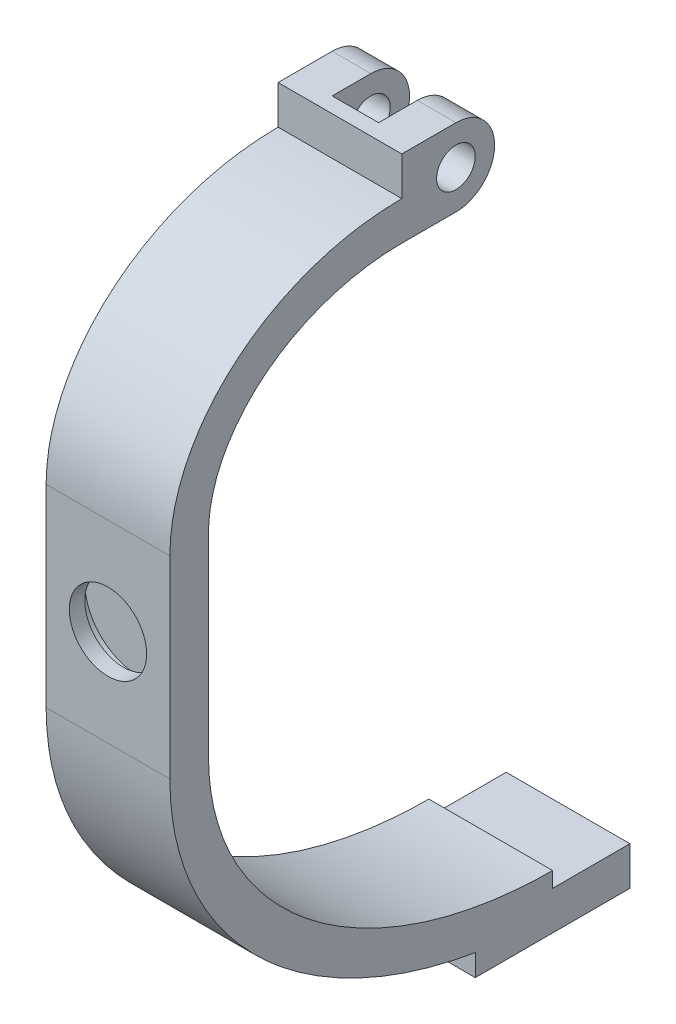
from build123d import *

# Parameters (mm, degrees)
BOSS_EXTRUDE2_DEPTH     = 10
CUT_EXTRUDE1_DEPTH      = 20.104973175
CUT_EXTRUDE1_DEPTH_BACK = 20.104973175
SKETCH3_R               = 2.5
SWEEP2_DEPTH            = 16
SKETCH6_W               = 16
SKETCH6_H               = 5
BOSS_EXTRUDE3_DEPTH     = 25
SWEEP4_DEPTH            = 16
BOSS_EXTRUDE6_START     = -2
BOSS_EXTRUDE6_DEPTH     = 5
MIRROR1_OUTLINE_W       = 5
MIRROR1_OUTLINE_H       = 10
MIRROR1_DEPTH           = 16
SKETCH10_R              = 5
CUT_EXTRUDE2_DEPTH      = 2
SKETCH11_R              = 7
CUT_EXTRUDE3_DEPTH      = 2
SKETCH12_R              = 5
CUT_EXTRUDE4_DEPTH      = 2
SKETCH13_R              = 7
CUT_EXTRUDE5_DEPTH      = 2
FILLET1_R               = 5


# Read off the part's stored shape, not the designer's step: Sweep2, Sweep4, Mirror1
with BuildPart() as part:
    # Sketch1 → Boss-Extrude2 (new body)
    with BuildSketch(Plane(origin=(0, 0, 0), x_dir=(1, 0, 0), z_dir=(0, 1, 0))):
        Polygon((16, 0), (11, 0), (11, -10), (5, -10), (5, 0), (0, 0), (0, -12), (16, -12), align=None)
    extrude(amount=BOSS_EXTRUDE2_DEPTH)

    # Sketch3 → Cut-Extrude1 (cut, two sides: drawn at the far end of the back side and taken through both)
    with BuildSketch(Plane(origin=(5, 0, 0), x_dir=(0, 0, -1), z_dir=(1, 0, 0)).offset(-CUT_EXTRUDE1_DEPTH_BACK)):
        with Locations((-5, 5)):
            Circle(SKETCH3_R)
    extrude(amount=CUT_EXTRUDE1_DEPTH + CUT_EXTRUDE1_DEPTH_BACK, mode=Mode.SUBTRACT)

    # Sweep2 outline → Sweep2 (add)
    with BuildSketch(Plane.YZ):
        with BuildLine():
            Line((0, 12), (5, 12))
            add(Edge.make_bspline(
                [(5, 12), (4.988564835, 13.918737728), (4.727583023, 17.475192083), (3.864503942, 21.128495988), (3.223332084, 23.150620925), (2.391953002, 25.596644311), (0.741742694, 29.07437946), (-1.195562511, 31.850987055), (-2.528545692, 33.517302555), (-4.236222293, 35.44635739), (-7.052881596, 37.829760239), (-9.410175401, 39.223738473), (-10.800753457, 39.913031483), (-12.581881784, 40.734670966), (-15.819763626, 41.734575995), (-18.630582656, 41.980830062), (-20, 42)],
                knots=[0, 0, 0, 0, 0.14, 0.25, 0.25, 0.28, 0.42, 0.5, 0.5, 0.56, 0.67, 0.75, 0.75, 0.78, 0.89, 1, 1, 1, 1], degree=3))
            Line((-20, 42), (-20, 37))
            add(Edge.make_bspline(
                [(0, 12), (0, 13.649915823), (-0.240561875, 16.726331061), (-0.97538393, 19.848301285), (-1.521193083, 21.57165859), (-2.228979288, 23.654488426), (-3.634756743, 26.603340395), (-5.233025509, 28.896620946), (-6.326493526, 30.263455967), (-7.72168743, 31.836224776), (-10.002621636, 33.761203681), (-11.850285326, 34.854843846), (-12.93353849, 35.390906407), (-14.317667102, 36.027380757), (-16.81674582, 36.792085808), (-18.962910054, 37), (-20, 37)],
                knots=[0, 0, 0, 0, 0.14, 0.25, 0.25, 0.28, 0.42, 0.5, 0.5, 0.56, 0.67, 0.75, 0.75, 0.78, 0.89, 1, 1, 1, 1], degree=3))
        make_face()
    extrude(amount=SWEEP2_DEPTH)

    # Sketch6 → Boss-Extrude3 (add)
    with BuildSketch(Plane.XZ.offset(20)):
        with Locations((8, 39.5)):
            Rectangle(SKETCH6_W, SKETCH6_H)
    extrude(amount=BOSS_EXTRUDE3_DEPTH)

    # Sweep4 outline → Sweep4 (add)
    with BuildSketch(Plane.YZ):
        with BuildLine():
            add(Edge.make_bspline(
                [(-45, 37), (-46.539921435, 37), (-49.710455321, 36.733564359), (-54.069426949, 35.591421338), (-56.791855208, 34.424962301), (-58.400322026, 33.61534539), (-60.515823703, 32.472825795), (-64.131778614, 29.955184919), (-67.512968495, 26.682711344), (-69.293125668, 24.545529462), (-70.568838354, 22.923551904), (-73.245629189, 19.149689178), (-75.823464115, 13.964627374), (-77.246943912, 9.829702386), (-78.247594027, 6.616051335), (-79.558969896, 1.063749954), (-80, -4.423299828), (-80, -7.5)],
                knots=[0, 0, 0, 0, 0.093333333, 0.186666667, 0.25, 0.25, 0.28, 0.373333333, 0.466666667, 0.5, 0.5, 0.56, 0.706666667, 0.75, 0.75, 0.853333333, 1, 1, 1, 1], degree=3))
            Line((-45, 37), (-45, 42))
            add(Edge.make_bspline(
                [(-45, 42), (-46.827228691, 41.985546272), (-50.572377089, 41.690203176), (-55.680170711, 40.34427149), (-58.86435237, 38.978190659), (-60.736493627, 38.036368786), (-63.19327858, 36.710836458), (-67.336625432, 33.820292899), (-71.161008214, 30.117283698), (-73.164977368, 27.709927549), (-74.598724896, 25.886689015), (-77.598031299, 21.658467407), (-80.427894177, 15.95136859), (-81.990291212, 11.413560853), (-83.08845552, 7.889758882), (-84.526539356, 1.812231065), (-84.988008876, -4.14655051), (-85, -7.5)],
                knots=[0, 0, 0, 0, 0.093333333, 0.186666667, 0.25, 0.25, 0.28, 0.373333333, 0.466666667, 0.5, 0.5, 0.56, 0.706666667, 0.75, 0.75, 0.853333333, 1, 1, 1, 1], degree=3))
            Line((-85, -7.5), (-80, -7.5))
        make_face()
    extrude(amount=SWEEP4_DEPTH)

    # 3DSketch1 → Boss-Extrude6 (add)
    with BuildSketch(Plane(origin=(0, -85, -7.5), x_dir=(0.8479983040050887, 0, 0.5299989400031789), z_dir=(0, 1, 0)).offset(BOSS_EXTRUDE6_START)):
        Polygon((0, 0), (13.567972864, 8.47998304), (18.867962264, 0), (5.2999894, -8.47998304), align=None)
    extrude(amount=BOSS_EXTRUDE6_DEPTH)

    # Mirror1 outline → Mirror1 (add)
    with BuildSketch(Plane.YZ):
        with Locations((-84.5, -12.5)):
            Rectangle(MIRROR1_OUTLINE_W, MIRROR1_OUTLINE_H)
    extrude(amount=MIRROR1_DEPTH)

    # Sketch10 → Cut-Extrude2 (cut)
    with BuildSketch(Plane.XY.offset(42)):
        with Locations((8, -32.5)):
            Circle(SKETCH10_R)
    extrude(amount=-CUT_EXTRUDE2_DEPTH, mode=Mode.SUBTRACT)

    # Sketch11 → Cut-Extrude3 (cut)
    with BuildSketch(Plane.XY.offset(40)):
        with Locations((8, -32.5)):
            Circle(SKETCH11_R)
    extrude(amount=-CUT_EXTRUDE3_DEPTH, mode=Mode.SUBTRACT)

    # Sketch12 → Cut-Extrude4 (cut)
    with BuildSketch(Plane.XZ.offset(87)):
        with Locations(Location((8, -7.5, 0), (0, 0, 270))):
            Circle(SKETCH12_R)
    extrude(amount=-CUT_EXTRUDE4_DEPTH, mode=Mode.SUBTRACT)

    # Sketch13 → Cut-Extrude5 (cut)
    with BuildSketch(Plane.XZ.offset(85)):
        with Locations(Location((8, -7.5, 0), (0, 0, 270))):
            Circle(SKETCH13_R)
    extrude(amount=-CUT_EXTRUDE5_DEPTH, mode=Mode.SUBTRACT)

    # Fillet1
    fillet1_edges = [part.edges().sort_by_distance(p)[0] for p in [
        (13.5, 10, 0),
        (13.5, 0, 0),
        (2.5, 0, 0),
        (2.5, 10, 0),
    ]]
    fillet(fillet1_edges, radius=FILLET1_R - 0.0001)  # a hair under: the kernel refuses the full size


solid = part.part
